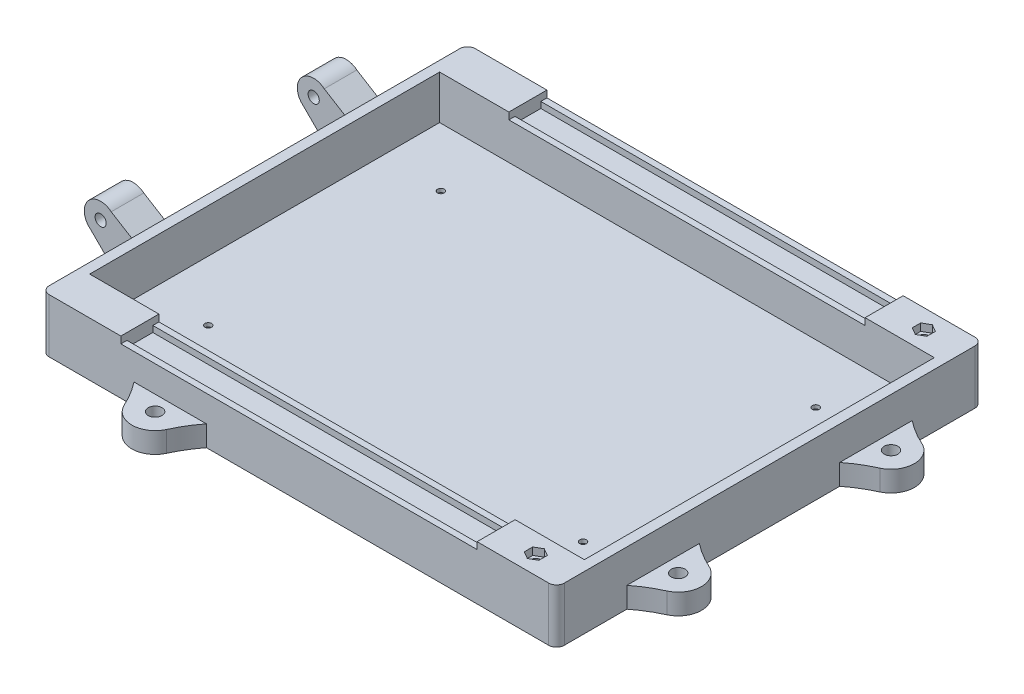
from build123d import *

# Parameters (mm, degrees)
SKETCH18_W           = 253.04
SKETCH18_H           = 171.92
BOSS_EXTRUDE6_DEPTH  = 26.5
SKETCH20_W           = 243.04
SKETCH20_H           = 171.92
CUT_EXTRUDE6_DEPTH   = 21.5
SKETCH22_W           = 253.04
SKETCH22_H           = 18.7
BOSS_EXTRUDE7_DEPTH  = 26.5
SKETCH23_W           = 253.04
SKETCH23_H           = 18.7
BOSS_EXTRUDE8_DEPTH  = 26.5
SKETCH24_W           = 175
SKETCH24_H           = 18.7
CUT_EXTRUDE7_DEPTH   = 3.35
SKETCH25_W           = 175
SKETCH25_H           = 18.7
CUT_EXTRUDE8_DEPTH   = 3.35
SKETCH27_W           = 175
SKETCH27_H           = 12.7
CUT_EXTRUDE9_DEPTH   = 3
SKETCH28_W           = 175
SKETCH28_H           = 12.7
CUT_EXTRUDE10_DEPTH  = 3
SKETCH31_R           = 1.65
CUT_EXTRUDE15_DEPTH  = 1.825
CUT_EXTRUDE17_DEPTH  = 3.175
SKETCH38_R           = 2.75
BOSS_EXTRUDE12_DEPTH = 8
SKETCH39_R           = 2.2
CUT_EXTRUDE18_DEPTH  = 26.5
SKETCH40_R           = 4.4
CUT_EXTRUDE19_DEPTH  = 20.9
FILLET1_R            = 3.81
CUT_EXTRUDE20_DEPTH  = 3.6
SKETCH45_R           = 3.3782
BOSS_EXTRUDE13_DEPTH = 10.16
SKETCH47_R           = 3.3782
BOSS_EXTRUDE14_DEPTH = 10.16


with BuildPart() as part:
    # Sketch18 → Boss-Extrude6 (new body)
    with BuildSketch(Plane(origin=(0, 0, 0), x_dir=(1, 0, 0), z_dir=(0, 1, 0))):
        Rectangle(SKETCH18_W, SKETCH18_H)
    extrude(amount=BOSS_EXTRUDE6_DEPTH)

    # Sketch20 → Cut-Extrude6 (cut)
    with BuildSketch(Plane(origin=(0, 26.5, 0), x_dir=(1, 0, 0), z_dir=(0, 1, 0))):
        Rectangle(SKETCH20_W, SKETCH20_H)
    extrude(amount=-CUT_EXTRUDE6_DEPTH, mode=Mode.SUBTRACT)

    # Sketch22 → Boss-Extrude7 (add)
    with BuildSketch(Plane(origin=(0, 0, 0), x_dir=(1, 0, 0), z_dir=(0, 1, 0))):
        with Locations((0, -95.31)):
            Rectangle(SKETCH22_W, SKETCH22_H)
    extrude(amount=BOSS_EXTRUDE7_DEPTH)

    # Sketch23 → Boss-Extrude8 (add)
    with BuildSketch(Plane(origin=(0, 0, 0), x_dir=(1, 0, 0), z_dir=(0, 1, 0))):
        with Locations((0, 95.31)):
            Rectangle(SKETCH23_W, SKETCH23_H)
    extrude(amount=BOSS_EXTRUDE8_DEPTH)

    # Sketch24 → Cut-Extrude7 (cut)
    with BuildSketch(Plane(origin=(0, 26.5, 0), x_dir=(1, 0, 0), z_dir=(0, 1, 0))):
        with Locations((0, 95.31)):
            Rectangle(SKETCH24_W, SKETCH24_H)
    extrude(amount=-CUT_EXTRUDE7_DEPTH, mode=Mode.SUBTRACT)

    # Sketch25 → Cut-Extrude8 (cut)
    with BuildSketch(Plane(origin=(0, 26.5, 0), x_dir=(1, 0, 0), z_dir=(0, 1, 0))):
        with Locations((0, -95.31)):
            Rectangle(SKETCH25_W, SKETCH25_H)
    extrude(amount=-CUT_EXTRUDE8_DEPTH, mode=Mode.SUBTRACT)

    # Sketch27 → Cut-Extrude9 (cut)
    with BuildSketch(Plane(origin=(0, 23.15, 0), x_dir=(1, 0, 0), z_dir=(0, 1, 0))):
        with Locations((0, -95.31)):
            Rectangle(SKETCH27_W, SKETCH27_H)
    extrude(amount=-CUT_EXTRUDE9_DEPTH, mode=Mode.SUBTRACT)

    # Sketch28 → Cut-Extrude10 (cut)
    with BuildSketch(Plane(origin=(0, 23.15, 0), x_dir=(1, 0, 0), z_dir=(0, 1, 0))):
        with Locations((0, 95.31)):
            Rectangle(SKETCH28_W, SKETCH28_H)
    extrude(amount=-CUT_EXTRUDE10_DEPTH, mode=Mode.SUBTRACT)

    # Sketch31 → Cut-Extrude15 (cut)
    with BuildSketch(Plane(origin=(0, 5, 0), x_dir=(1, 0, 0), z_dir=(0, 1, 0))):
        with Locations((-92.07, 57.15)):
            Circle(SKETCH31_R)
        with Locations((92.07, 57.15)):
            Circle(SKETCH31_R)
        with Locations((92.07, -57.15)):
            Circle(SKETCH31_R)
        with Locations((-92.07, -57.15)):
            Circle(SKETCH31_R)
    extrude(amount=-CUT_EXTRUDE15_DEPTH, mode=Mode.SUBTRACT)

    # Sketch33 → Cut-Extrude17 (cut)
    with BuildSketch(Plane.XZ):
        Polygon((-88.938971755, -58.9577), (-88.938971755, -55.3423), (-92.07, -53.5346), (-95.201028245, -55.3423), (-95.201028245, -58.9577), (-92.07, -60.7654), align=None)
        Polygon((95.201028245, -58.9577), (95.201028245, -55.3423), (92.07, -53.5346), (88.938971755, -55.3423), (88.938971755, -58.9577), (92.07, -60.7654), align=None)
        Polygon((-88.938971755, 58.9577), (-92.07, 60.7654), (-95.201028245, 58.9577), (-95.201028245, 55.3423), (-92.07, 53.5346), (-88.938971755, 55.3423), align=None)
        Polygon((88.938971755, 58.9577), (88.938971755, 55.3423), (92.07, 53.5346), (95.201028245, 55.3423), (95.201028245, 58.9577), (92.07, 60.7654), align=None)
    extrude(amount=-CUT_EXTRUDE17_DEPTH, mode=Mode.SUBTRACT)

    # Sketch38 → Boss-Extrude12 (add, symmetric)
    with BuildSketch(Plane.XY.offset(-52.33)):
        with BuildLine():
            Line((-126.52, 0), (-146.955863104, 20.352550116))
            ThreePointArc((-146.955863104, 20.352550116), (-147.906416884, 31.696896104), (-136.562070896, 32.647449884))
            Line((-136.562070896, 32.647449884), (-126.52, 26.5))
            Line((-126.52, 26.5), (-126.52, 0))
        make_face()
        with Locations((-141.758967, 26.5)):
            Circle(SKETCH38_R, mode=Mode.SUBTRACT)
    boss_extrude12 = extrude(amount=BOSS_EXTRUDE12_DEPTH, both=True)

    # Mirror2: Boss-Extrude12 across plane
    add(boss_extrude12.mirror(Plane.XY))

    # Sketch39 → Cut-Extrude18 (cut)
    with BuildSketch(Plane(origin=(0, 26.5, 0), x_dir=(1, 0, 0), z_dir=(0, 1, 0))):
        with Locations((107.01, 95.31)):
            Circle(SKETCH39_R)
    cut_extrude18 = extrude(amount=-CUT_EXTRUDE18_DEPTH, mode=Mode.SUBTRACT)

    # Sketch40 → Cut-Extrude19 (cut)
    with BuildSketch(Plane.XZ):
        with Locations((107.01, -95.31)):
            Circle(SKETCH40_R)
    cut_extrude19 = extrude(amount=-CUT_EXTRUDE19_DEPTH, mode=Mode.SUBTRACT)

    # Mirror3: Cut-Extrude18 across plane
    add(cut_extrude18.mirror(Plane.XY), mode=Mode.SUBTRACT)

    # Mirror4: Cut-Extrude19 across plane
    add(cut_extrude19.mirror(Plane.XY), mode=Mode.SUBTRACT)

    # Fillet1
    fillet1_edges = [part.edges().sort_by_distance(p)[0] for p in [
        (126.52, 13.25, 104.66),
        (-126.52, 13.25, 104.66),
        (-126.52, 13.25, -104.66),
        (126.52, 13.25, -104.66),
    ]]
    fillet(fillet1_edges, radius=FILLET1_R)

    # Sketch41 → Cut-Extrude20 (cut)
    with BuildSketch(Plane(origin=(0, 26.5, 0), x_dir=(1, 0, 0), z_dir=(0, 1, 0))):
        Polygon((107.01, -91.153078062), (103.41, -93.231539031), (103.41, -97.388460969), (107.01, -99.466921938), (110.61, -97.388460969), (110.61, -93.231539031), align=None)
    cut_extrude20 = extrude(amount=-CUT_EXTRUDE20_DEPTH, mode=Mode.SUBTRACT)

    # Mirror5: Cut-Extrude20 across plane
    add(cut_extrude20.mirror(Plane.XY), mode=Mode.SUBTRACT)

    # Sketch45 → Boss-Extrude13 (add)
    with BuildSketch(Plane.XZ):
        with BuildLine():
            ThreePointArc((-73.613027012, 116.942639176), (-76.961998074, 110.573343689), (-81.06271735, 104.66))
            Line((-81.06271735, 104.66), (-45.45728265, 104.66))
            ThreePointArc((-45.45728265, 104.66), (-49.558001926, 110.573343689), (-52.906972988, 116.942639176))
            ThreePointArc((-52.906972988, 116.942639176), (-63.26, 123.515804866), (-73.613027012, 116.942639176))
        make_face()
        with Locations((-63.26, 112.075804866)):
            Circle(SKETCH45_R, mode=Mode.SUBTRACT)
    extrude(amount=-BOSS_EXTRUDE13_DEPTH)

    # Sketch47 → Boss-Extrude14 (add)
    with BuildSketch(Plane.XZ):
        with BuildLine():
            ThreePointArc((138.802639176, -41.925834239), (132.433343689, -38.576863177), (126.52, -34.476143901))
            Line((126.52, -34.476143901), (126.52, -70.081578601))
            ThreePointArc((126.52, -70.081578601), (132.433343689, -65.980859325), (138.802639176, -62.631888263))
            ThreePointArc((138.802639176, -62.631888263), (145.375804866, -52.278861251), (138.802639176, -41.925834239))
        make_face()
        with Locations((133.935804866, -52.278861251)):
            Circle(SKETCH47_R, mode=Mode.SUBTRACT)
    boss_extrude14 = extrude(amount=-BOSS_EXTRUDE14_DEPTH)

    # Mirror8: Boss-Extrude14 across plane
    add(boss_extrude14.mirror(Plane.XY))


solid = part.part
